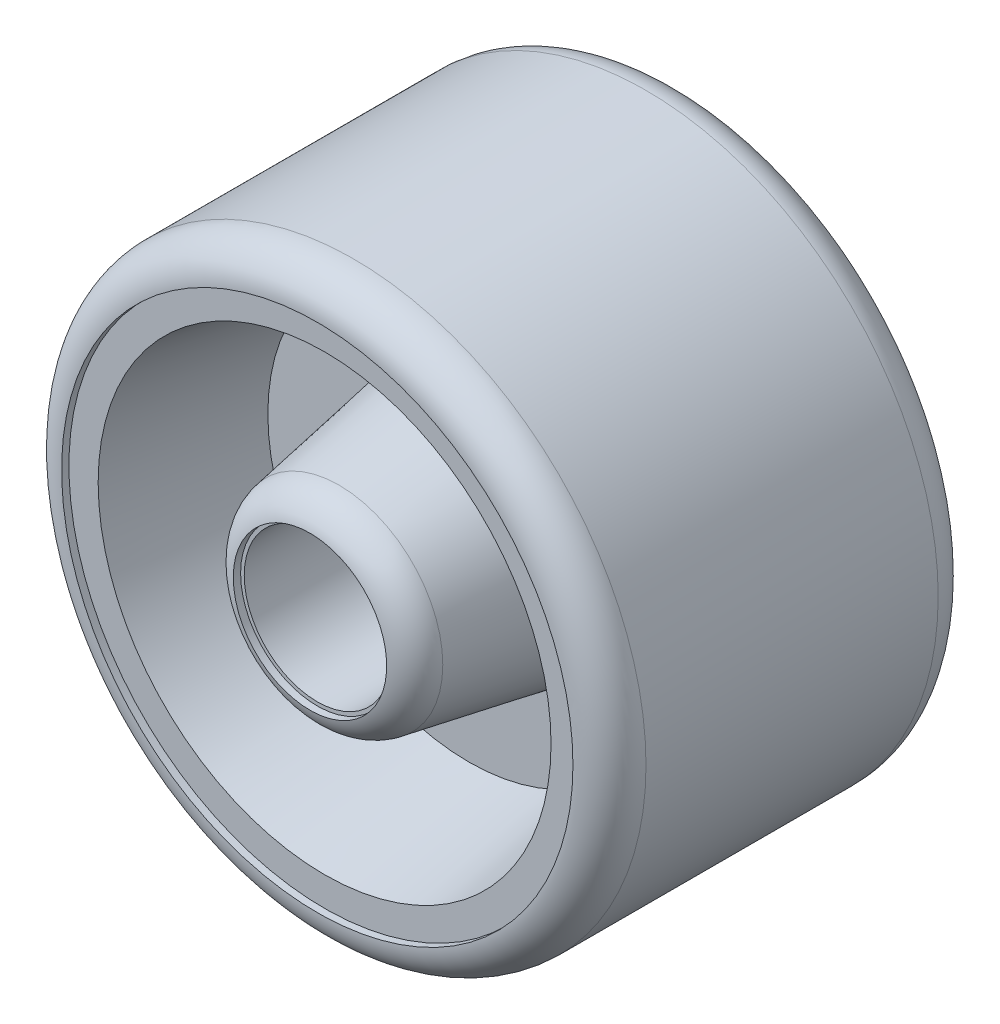
from build123d import *

# Parameters (mm, degrees)
SKETCH1_R           = 7.999999999999998
SKETCH1_R_2         = 7
BOSS_EXTRUDE1_DEPTH = 5
FILLET1_R           = 1
BOSS_EXTRUDE2_DEPTH = 0.85
SKETCH4_R           = 2
CUT_EXTRUDE1_DEPTH  = 16.23285921946369
FILLET3_R           = 1
FILLET4_R           = 1


# Some blends are built 0.0001 mm under size
with BuildPart() as part:
    # Sketch1 → Boss-Extrude1 (new, symmetric)
    with BuildSketch(Plane.XY):
        Circle(SKETCH1_R)
        Circle(SKETCH1_R_2, mode=Mode.SUBTRACT)
    extrude(amount=BOSS_EXTRUDE1_DEPTH, both=True)

    # Fillet1
    fillet1_edges = [part.edges().sort_by_distance(p)[0] for p in [
        (-7.999999999999998, 9.8e-16, -5),
        (-7.999999999999998, 9.8e-16, 5),
    ]]
    fillet(fillet1_edges, radius=FILLET1_R - 0.0001)  # a hair under: the kernel refuses the full size

    # Sketch2 → Revolve1 (revolve)
    with BuildSketch(Plane(origin=(0, 0, 0), x_dir=(1, 0, 0), z_dir=(0, 1, 0))):
        Polygon((4e-17, 5), (1.26e-15, -5), (-2.099999999999999, -4.999999999999999), (-2.0999999999999996, -5.200000000000002), (-2.6999999999999993, -5.200000000000002), (-3.4670223660818085, -0.8500000000000001), (-5.503508426201579, -0.8500000000000006), (-6.199999999999999, -4.800000000000001), (-6.999999999999999, -4.800000000000001), (-7, 4.799999999999999), (-6.2, 4.799999999999999), (-5.503508426201579, 0.8499999999999993), (-3.4670223660818085, 0.8499999999999992), (-2.7000000000000006, 5.200000000000002), (-2.1000000000000005, 5.200000000000002), (-2.1, 4.999999999999999), align=None)
    revolve(axis=Axis((4e-17, 0, -5), (1.2e-16, 0, 1)))

    # Sketch3 → Boss-Extrude2 (add, symmetric)
    with BuildSketch(Plane(origin=(0, 0, 0), x_dir=(1, 0, 0), z_dir=(0, 1, 0))):
        Polygon((-2.546735183281943, 2.550000000000001), (-2.546735183281943, 0.8500000000000001), (-4.546735183281943, 0.850000000000001), (-4.546735183281943, 1.15), (-2.846735183281943, 2.5500000000000003), align=None)
    extrude(amount=BOSS_EXTRUDE2_DEPTH, both=True)

    # Sketch4 → Cut-Extrude1 (cut, through all)
    with BuildSketch(Plane(origin=(-6.1e-16, 0, -4.999999999999999), x_dir=(-1, 0, 0), z_dir=(0, 0, -1))):
        Circle(SKETCH4_R)
    extrude(amount=-CUT_EXTRUDE1_DEPTH, mode=Mode.SUBTRACT)

    # Fillet3
    # the kernel refuses this fillet: 1 mm, written as the material it takes off along each edge
    with BuildSketch(Plane(origin=(1.29e-15, 0, 5.200000000000003), x_dir=(-1, 0, 0), z_dir=(0, 1, 0))) as fillet3_piece_1:
        with BuildLine():
            CenterArc((1.8555509868612252, -0.9696621473355957), FILLET3_R, 9.99999999999983, 65.85072553441276)
            Line((2.100000000000001, 0), (2.1048889802627766, 0.01939324294671163))
            ThreePointArc((2.1048889802627766, 0.01939324294671163), (2.4000000000000004, 0.01999999999999957), (2.7000000000000006, 0.01999999999999957))
            Line((2.7000000000000006, 0.01999999999999957), (2.719696155060245, 0.00347296355333881))
            Line((2.719696155060245, 0.00347296355333881), (2.860054894933678, -0.7925410061153295))
            Line((2.860054894933678, -0.7925410061153295), (2.840358739873434, -0.7960139696686683))
        make_face()
    revolve(axis=Axis((1.29e-15, 0, 5.200000000000003), (1.2e-16, 0, 1)), mode=Mode.SUBTRACT)

    # Fillet4
    # the kernel refuses this fillet: 1 mm, written as the material it takes off along each edge
    with BuildSketch(Plane(origin=(1e-17, 0, -5.200000000000002), x_dir=(-1, 0, 0), z_dir=(0, 1, 0))) as fillet4_piece_1:
        with BuildLine():
            CenterArc((1.8555509868612252, 0.9696621473355957), FILLET4_R, 284.1492744655874, 65.85072553441279)
            Line((2.1000000000000005, 0), (2.104888980262776, -0.01939324294671163))
            ThreePointArc((2.104888980262776, -0.01939324294671163), (2.4000000000000004, -0.01999999999999957), (2.7000000000000006, -0.01999999999999957))
            Line((2.7000000000000006, -0.01999999999999957), (2.719696155060245, -0.00347296355333881))
            Line((2.719696155060245, -0.00347296355333881), (2.860054894933678, 0.7925410061153295))
            Line((2.860054894933678, 0.7925410061153295), (2.840358739873434, 0.7960139696686683))
        make_face()
    revolve(axis=Axis((1e-17, 0, -5.200000000000002), (1.2e-16, 0, 1)), mode=Mode.SUBTRACT)


solid = part.part
